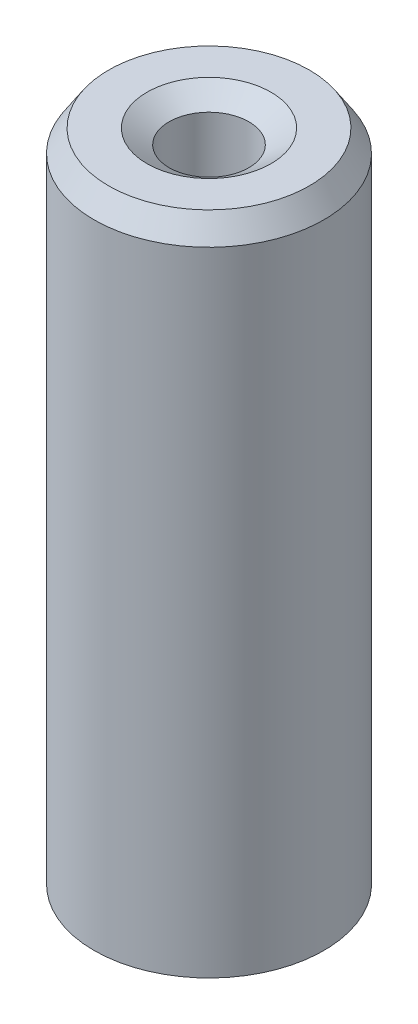
from build123d import *
from OCP.BRepFilletAPI import BRepFilletAPI_MakeChamfer

# Parameters (mm, degrees)
SKETCH1_R           = 15
BOSS_EXTRUDE1_DEPTH = 87.380561929
SKETCH2_R           = 5.202454625
CUT_EXTRUDE1_DEPTH  = 90.918644357
CHAMFER1_SIZE       = 2.888431437
CHAMFER1_SIZE2      = 1.897049756


with BuildPart() as part:
    # Sketch1 → Boss-Extrude1 (new body)
    with BuildSketch(Plane(origin=(0, 0, 0), x_dir=(1, 0, 0), z_dir=(0, 1, 0))):
        Circle(SKETCH1_R)
    extrude(amount=BOSS_EXTRUDE1_DEPTH)

    # Sketch2 → Cut-Extrude1 (cut, through all)
    with BuildSketch(Plane(origin=(0, 0, 0), x_dir=(1, 0, 0), z_dir=(0, 1, 0))):
        Circle(SKETCH2_R)
    extrude(amount=CUT_EXTRUDE1_DEPTH, mode=Mode.SUBTRACT)

    # Chamfer1: one chamfer whose edges measure the first distance from different faces: ONE call of the kernel's chamfer builder (chamfer() names one face for all edges)
    chamfer1_edges_1 = [part.edges().sort_by_distance(p)[0] for p in [
        (-5.202454625, 87.380561929, 0),
    ]]
    chamfer1_side_1 = [part.faces().sort_by_distance(p)[0] for p in [
        (-14.575735931, 87.380561929, 0),
    ]]
    chamfer1_edges_2 = [part.edges().sort_by_distance(p)[0] for p in [
        (-5.202454625, 0, 0),
    ]]
    chamfer1_side_2 = [part.faces().sort_by_distance(p)[0] for p in [
        (-5.202454625, 43.690280965, 0),
    ]]
    chamfer1_edges_3 = [part.edges().sort_by_distance(p)[0] for p in [
        (-15, 0, 0),
    ]]
    chamfer1_side_3 = [part.faces().sort_by_distance(p)[0] for p in [
        (-14.575735931, 0, 0),
    ]]
    chamfer1_edges_4 = [part.edges().sort_by_distance(p)[0] for p in [
        (-15, 87.380561929, 0),
    ]]
    chamfer1_side_4 = [part.faces().sort_by_distance(p)[0] for p in [
        (-15, 43.690280965, 0),
    ]]
    chamfer1 = BRepFilletAPI_MakeChamfer(part.part.solid().wrapped)
    for e in chamfer1_edges_1:
        chamfer1.Add(CHAMFER1_SIZE, CHAMFER1_SIZE2, e.wrapped, chamfer1_side_1[0].wrapped)  # the first distance lies on this face
    for e in chamfer1_edges_2:
        chamfer1.Add(CHAMFER1_SIZE, CHAMFER1_SIZE2, e.wrapped, chamfer1_side_2[0].wrapped)  # the first distance lies on this face
    for e in chamfer1_edges_3:
        chamfer1.Add(CHAMFER1_SIZE, CHAMFER1_SIZE2, e.wrapped, chamfer1_side_3[0].wrapped)  # the first distance lies on this face
    for e in chamfer1_edges_4:
        chamfer1.Add(CHAMFER1_SIZE, CHAMFER1_SIZE2, e.wrapped, chamfer1_side_4[0].wrapped)  # the first distance lies on this face
    add(Compound.cast(chamfer1.Shape()), mode=Mode.REPLACE)


solid = part.part
